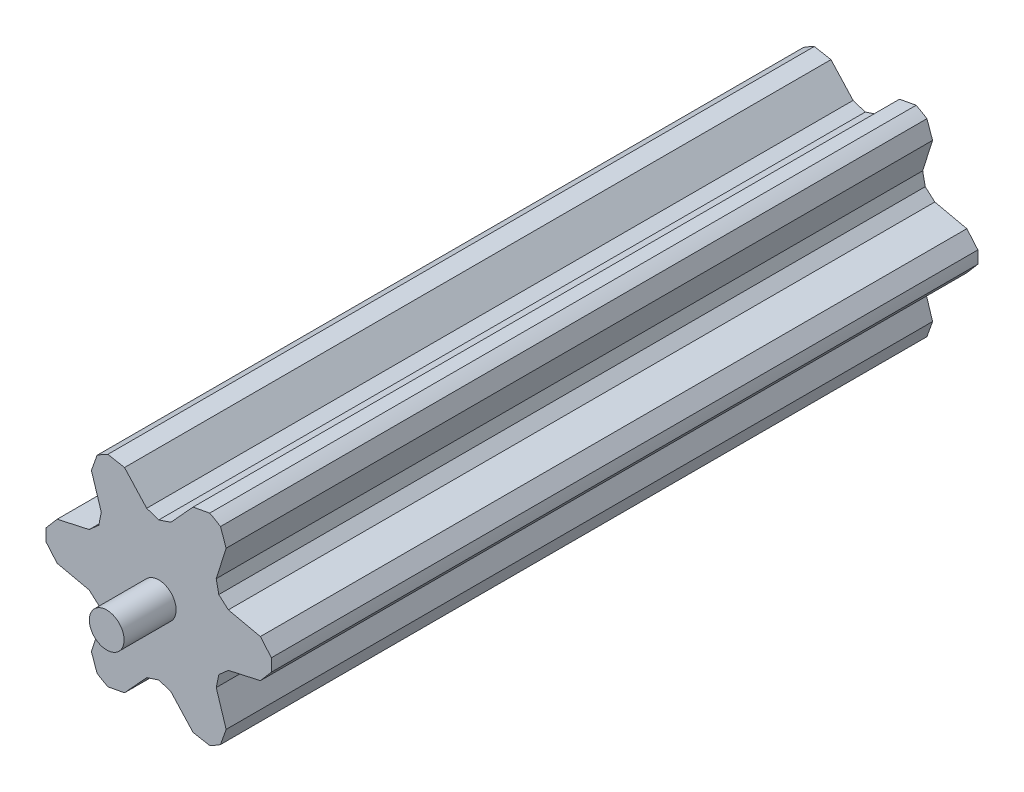
from build123d import *

# Parameters (mm, degrees)
SKETCH1_R           = 6.5
BOSS_EXTRUDE1_DEPTH = 40.71
CUT_EXTRUDE1_DEPTH  = 42.73492662
CIRPATTERN1_COUNT   = 6
SKETCH4_R           = 1
BOSS_EXTRUDE2_DEPTH = 3


with BuildPart() as part:
    # Sketch1 → Boss-Extrude1 (new body)
    with BuildSketch(Plane.XY):
        Circle(SKETCH1_R)
    extrude(amount=BOSS_EXTRUDE1_DEPTH)

    # Sketch2 → Cut-Extrude1 (cut, through all)
    with BuildSketch(Plane.XY):
        Polygon((0, 3.994046711), (-0.697770289, 4.226008341), (-1.974107131, 5.621832619), (-2.934011689, 5.800135809), (-3.466803954, 8.711819893), (0, 10.612735431), (3.466803954, 8.711819893), (2.934011689, 5.800135809), (1.974107131, 5.621832619), (0.697770289, 4.226008341), align=None)
    cut_extrude1 = extrude(amount=CUT_EXTRUDE1_DEPTH, mode=Mode.SUBTRACT)

    # CirPattern1: Cut-Extrude1 ×6 about axis
    cirpattern1_axis = Axis((0, 0, 40.71), (0, 0, -1))
    for i in range(1, CIRPATTERN1_COUNT):
        add(cut_extrude1.rotate(cirpattern1_axis, i * 360 / CIRPATTERN1_COUNT), mode=Mode.SUBTRACT)

    # Sketch4 → Boss-Extrude2 (add)
    with BuildSketch(Plane.XY.offset(40.71)):
        Circle(SKETCH4_R)
    extrude(amount=BOSS_EXTRUDE2_DEPTH)


solid = part.part
